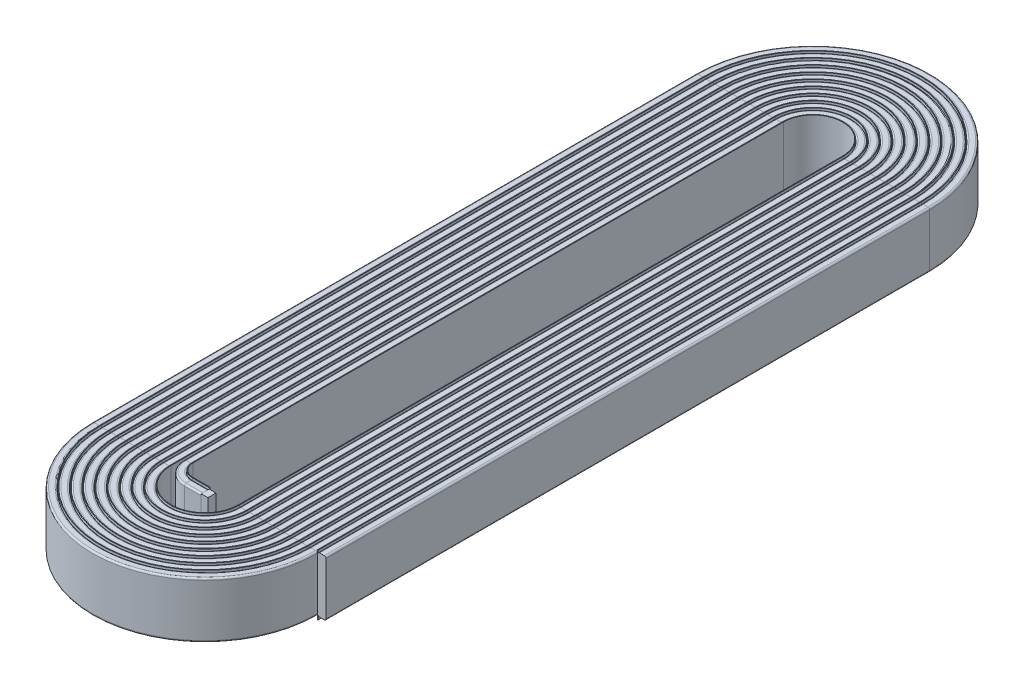
from build123d import *

# Parameters (mm, degrees)
SKETCH_1_W             = 0.1
SKETCH_1_H             = 9
SKETCH_3_W             = 1.2
SKETCH_3_H             = 8.3
SM_BASE_FLANGE_1_DEPTH = 1


# Sheet-metal steps are written as plain solids
with BuildPart() as part:
    # По траектории5: sweep along a path in Sketch 279
    with BuildLine(Plane(origin=(0, 0, 0), x_dir=(1, 0, 0), z_dir=(0, 1, 0))) as sweep_5_path:
        Line((0, 0), (-2.5, 0))
        ThreePointArc((-2.5, 0), (-3.914213562, 0.585786438), (-4.5, 2))
        Line((-4.5, 2), (-4.5, 90))
        ThreePointArc((-4.5, 90), (0, 94.5), (4.5, 90))
        Line((4.5, 90), (4.5, 0))
        ThreePointArc((4.5, 0), (-0.65, -5.15), (-5.8, 0))
        Line((-5.8, 0), (-5.8, 90))
        ThreePointArc((-5.8, 90), (0, 95.8), (5.8, 90))
        Line((5.8, 90), (5.8, 0))
        ThreePointArc((5.8, 0), (-0.65, -6.45), (-7.1, 0))
        Line((-7.1, 0), (-7.1, 90))
        ThreePointArc((-7.1, 90), (0, 97.1), (7.1, 90))
        Line((7.1, 90), (7.1, 0))
        ThreePointArc((7.1, 0), (-0.65, -7.75), (-8.4, 0))
        Line((-8.4, 0), (-8.4, 90))
        ThreePointArc((-8.4, 90), (0, 98.4), (8.4, 90))
        Line((8.4, 90), (8.4, 0))
        ThreePointArc((8.4, 0), (-0.65, -9.05), (-9.7, 0))
        Line((-9.7, 0), (-9.7, 90))
        ThreePointArc((-9.7, 90), (0, 99.7), (9.7, 90))
        Line((9.7, 90), (9.7, 0))
        ThreePointArc((9.7, 0), (-0.65, -10.35), (-11, 0))
        Line((-11, 0), (-11, 90))
        ThreePointArc((-11, 90), (0, 101), (11, 90))
        Line((11, 90), (11, 0))
        ThreePointArc((11, 0), (-0.65, -11.65), (-12.3, 0))
        Line((-12.3, 0), (-12.3, 90))
        ThreePointArc((-12.3, 90), (0, 102.3), (12.3, 90))
        Line((12.3, 90), (12.3, 0))
        ThreePointArc((12.3, 0), (-0.65, -12.95), (-13.6, 0))
        Line((-13.6, 0), (-13.6, 90))
        ThreePointArc((-13.6, 90), (0, 103.6), (13.6, 90))
        Line((13.6, 90), (13.6, 0))
        ThreePointArc((13.6, 0), (-0.65, -14.25), (-14.9, 0))
        Line((-14.9, 0), (-14.9, 90))
        ThreePointArc((-14.9, 90), (0, 104.9), (14.9, 90))
        Line((14.9, 90), (14.9, 0))
        ThreePointArc((14.9, 0), (-0.65, -15.55), (-16.2, 0))
        Line((-16.2, 0), (-16.2, 90))
        ThreePointArc((-16.2, 90), (0, 106.2), (16.2, 90))
        Line((16.2, 90), (16.2, 0))
    # Sketch 1441 → По траектории5 (sweep)
    with BuildSketch(Plane(origin=(0, 0, 0), x_dir=(0, 0, -1), z_dir=(1, 0, 0))):
        with BuildLine():
            Line((-0.25, 0), (-0.95, 0))
            ThreePointArc((-0.95, 0), (-1.126776695, 0.073223305), (-1.2, 0.25))
            Line((-1.2, 0.25), (-1.2, 8.05))
            ThreePointArc((-1.2, 8.05), (-1.126776695, 8.226776695), (-0.95, 8.3))
            Line((-0.95, 8.3), (-0.25, 8.3))
            ThreePointArc((-0.25, 8.3), (-0.073223305, 8.226776695), (0, 8.05))
            Line((0, 8.05), (0, 0.25))
            ThreePointArc((0, 0.25), (-0.073223305, 0.073223305), (-0.25, 0))
        make_face()
    sweep(path=sweep_5_path.line)

    # По траектории6: sweep along a path in Траектория намотки<2>
    with BuildLine(Plane(origin=(0, 0, 0), x_dir=(1, 0, 0), z_dir=(0, 1, 0))) as sweep_6_path:
        Line((0, 0), (-2.5, 0))
        ThreePointArc((-2.5, 0), (-3.914213562, 0.585786438), (-4.5, 2))
        Line((-4.5, 2), (-4.5, 90))
        ThreePointArc((-4.5, 90), (0, 94.5), (4.5, 90))
        Line((4.5, 90), (4.5, 0))
        ThreePointArc((4.5, 0), (-0.65, -5.15), (-5.8, 0))
        Line((-5.8, 0), (-5.8, 90))
        ThreePointArc((-5.8, 90), (0, 95.8), (5.8, 90))
        Line((5.8, 90), (5.8, 0))
        ThreePointArc((5.8, 0), (-0.65, -6.45), (-7.1, 0))
        Line((-7.1, 0), (-7.1, 90))
        ThreePointArc((-7.1, 90), (0, 97.1), (7.1, 90))
        Line((7.1, 90), (7.1, 0))
        ThreePointArc((7.1, 0), (-0.65, -7.75), (-8.4, 0))
        Line((-8.4, 0), (-8.4, 90))
        ThreePointArc((-8.4, 90), (0, 98.4), (8.4, 90))
        Line((8.4, 90), (8.4, 0))
        ThreePointArc((8.4, 0), (-0.65, -9.05), (-9.7, 0))
        Line((-9.7, 0), (-9.7, 90))
        ThreePointArc((-9.7, 90), (0, 99.7), (9.7, 90))
        Line((9.7, 90), (9.7, 0))
        ThreePointArc((9.7, 0), (-0.65, -10.35), (-11, 0))
        Line((-11, 0), (-11, 90))
        ThreePointArc((-11, 90), (0, 101), (11, 90))
        Line((11, 90), (11, 0))
        ThreePointArc((11, 0), (-0.65, -11.65), (-12.3, 0))
        Line((-12.3, 0), (-12.3, 90))
        ThreePointArc((-12.3, 90), (0, 102.3), (12.3, 90))
        Line((12.3, 90), (12.3, 0))
        ThreePointArc((12.3, 0), (-0.65, -12.95), (-13.6, 0))
        Line((-13.6, 0), (-13.6, 90))
        ThreePointArc((-13.6, 90), (0, 103.6), (13.6, 90))
        Line((13.6, 90), (13.6, 0))
        ThreePointArc((13.6, 0), (-0.65, -14.25), (-14.9, 0))
        Line((-14.9, 0), (-14.9, 90))
        ThreePointArc((-14.9, 90), (0, 104.9), (14.9, 90))
        Line((14.9, 90), (14.9, 0))
        ThreePointArc((14.9, 0), (-0.65, -15.55), (-16.2, 0))
        Line((-16.2, 0), (-16.2, 90))
        ThreePointArc((-16.2, 90), (0, 106.2), (16.2, 90))
        Line((16.2, 90), (16.2, 0))
    # Sketch 1 → По траектории6 (sweep)
    with BuildSketch(Plane(origin=(0, 0, 0), x_dir=(0, 0, -1), z_dir=(1, 0, 0))):
        with Locations((0.05, 4)):
            Rectangle(SKETCH_1_W, SKETCH_1_H)
    sweep(path=sweep_6_path.line)


with BuildPart() as body_2:
    # Эскиз3 → Базовая кромка1 (new body)
    with BuildSketch(Plane(origin=(0, 0, 0), x_dir=(0, 0, -1), z_dir=(1, 0, 0))):
        with Locations((-0.6, 4.15)):
            Rectangle(SKETCH_3_W, SKETCH_3_H)
    extrude(amount=SM_BASE_FLANGE_1_DEPTH)


solid = Compound([part.part, body_2.part])
